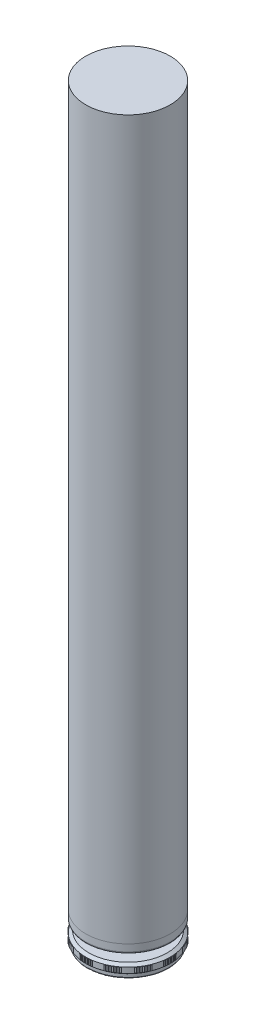
from build123d import *

# Parameters (mm, degrees)
CHANFREIN1_SIZE              = 2
CHANFREIN1_SIZE2             = 2.856296013
CONG_1_R                     = 2
CHANFREIN2_SIZE2             = 1.5
CHANFREIN2_SIZE              = 1.258649447
CONG_2_R                     = 1
BOSS_EXTRU_1_REACH           = 61.674
R_P_TITION_CIRCULAIRE1_COUNT = 12
ESQUISSE3_R                  = 40
BOSS_EXTRU_2_DEPTH           = 680


with BuildPart() as part:
    # Esquisse1 → Révolution1 (revolve)
    with BuildSketch(Plane.XY):
        Polygon((-25, 6.25), (-25, -2.25), (-40, -2.25), (-40, -10.75), (-38.5, -10.75), (-38.5, -14.75), (0, -14.75), (0, 14.75), (-40, 14.75), (-40, 6.25), align=None)
    revolve(axis=Axis((0, 36.374456522, 0), (0, -1, 0)))

    # Chanfrein1
    chanfrein1_edges = [part.edges().sort_by_distance(p)[0] for p in [
        (40, -2.25, 0),
    ]]
    chanfrein1_side = [part.faces().sort_by_distance(p)[0] for p in [
        (40, -6.5, 0),
    ]]
    chamfer(chanfrein1_edges, length=CHANFREIN1_SIZE, length2=CHANFREIN1_SIZE2, reference=chanfrein1_side[0])

    # Congé1
    cong_1_edges = [part.edges().sort_by_distance(p)[0] for p in [
        (40, 6.25, 0),
    ]]
    fillet(cong_1_edges, radius=CONG_1_R)

    # Chanfrein2
    chanfrein2_edges = [part.edges().sort_by_distance(p)[0] for p in [
        (40, -10.75, 0),
    ]]
    chanfrein2_side = [part.faces().sort_by_distance(p)[0] for p in [
        (40, -10.724827011, 0),
    ]]
    chamfer(chanfrein2_edges, length=CHANFREIN2_SIZE - 0.0001, length2=CHANFREIN2_SIZE2 - 0.0001, reference=chanfrein2_side[0])  # a hair under: the kernel refuses the full size

    # Congé2
    cong_2_edges = [part.edges().sort_by_distance(p)[0] for p in [
        (38.5, -14.75, 0),
    ]]
    fillet(cong_2_edges, radius=CONG_2_R)

    # Boss.-Extru.1: up to this cone (the profile starts inside it)
    boss_extru_1_end = Plane(origin=(0, -4.25, 0), z_dir=(0, 1, 0)).offset(-38.8053348) * Cone(1.192e-06, 175.456797598, 147.225733152, align=(Align.CENTER, Align.CENTER, Align.MIN), mode=Mode.PRIVATE)
    # Esquisse2 → Boss.-Extru.1 (add, up to the surface)
    with BuildSketch(Plane.XZ.offset(4.25), mode=Mode.PRIVATE) as boss_extru_1_sk1:
        with BuildLine():
            ThreePointArc((-4.915234348, -39.696857197), (-5.458128489, -39.625860664), (-6, -39.547439867))
            ThreePointArc((-6, -39.547439867), (-5.532838904, -40.168256193), (-4.915234348, -39.696857197))
        make_face()
    boss_extru_1_tool1 = extrude(boss_extru_1_sk1.sketch, amount=BOSS_EXTRU_1_REACH, mode=Mode.PRIVATE) & boss_extru_1_end
    # Esquisse2 → Boss.-Extru.1 (add, up to the surface)
    with BuildSketch(Plane.XZ.offset(4.25), mode=Mode.PRIVATE) as boss_extru_1_sk2:
        with BuildLine():
            ThreePointArc((-3.826785213, -39.816525651), (-4.371419293, -39.760416162), (-4.915234348, -39.696857197))
            ThreePointArc((-4.915234348, -39.696857197), (-4.431254922, -40.304653476), (-3.826785213, -39.816525651))
        make_face()
    boss_extru_1_tool2 = extrude(boss_extru_1_sk2.sketch, amount=BOSS_EXTRU_1_REACH, mode=Mode.PRIVATE) & boss_extru_1_end
    # Esquisse2 → Boss.-Extru.1 (add, up to the surface)
    with BuildSketch(Plane.XZ.offset(4.25), mode=Mode.PRIVATE) as boss_extru_1_sk3:
        with BuildLine():
            ThreePointArc((-2.73546828, -39.90635555), (-3.28143415, -39.865175152), (-3.826785213, -39.816525651))
            ThreePointArc((-3.826785213, -39.816525651), (-3.326350151, -40.410846398), (-2.73546828, -39.90635555))
        make_face()
    boss_extru_1_tool3 = extrude(boss_extru_1_sk3.sketch, amount=BOSS_EXTRU_1_REACH, mode=Mode.PRIVATE) & boss_extru_1_end
    # Esquisse2 → Boss.-Extru.1 (add, up to the surface)
    with BuildSketch(Plane.XZ.offset(4.25), mode=Mode.PRIVATE) as boss_extru_1_sk4:
        with BuildLine():
            ThreePointArc((-1.642101384, -39.966279575), (-2.188989895, -39.940059129), (-2.73546828, -39.90635555))
            ThreePointArc((-2.73546828, -39.90635555), (-2.21895261, -40.486755381), (-1.642101384, -39.966279575))
        make_face()
    boss_extru_1_tool4 = extrude(boss_extru_1_sk4.sketch, amount=BOSS_EXTRU_1_REACH, mode=Mode.PRIVATE) & boss_extru_1_end
    # Esquisse2 → Boss.-Extru.1 (add, up to the surface)
    with BuildSketch(Plane.XZ.offset(4.25), mode=Mode.PRIVATE) as boss_extru_1_sk5:
        with BuildLine():
            ThreePointArc((-0.547503895, -39.996252818), (-1.094905209, -39.985011974), (-1.642101384, -39.966279575))
            ThreePointArc((-1.642101384, -39.966279575), (-1.109892182, -40.532323537), (-0.547503895, -39.996252818))
        make_face()
    boss_extru_1_tool5 = extrude(boss_extru_1_sk5.sketch, amount=BOSS_EXTRU_1_REACH, mode=Mode.PRIVATE) & boss_extru_1_end
    # Esquisse2 → Boss.-Extru.1 (add, up to the surface)
    with BuildSketch(Plane.XZ.offset(4.25), mode=Mode.PRIVATE) as boss_extru_1_sk6:
        with BuildLine():
            ThreePointArc((0.547503895, -39.996252818), (0, -40), (-0.547503895, -39.996252818))
            ThreePointArc((-0.547503895, -39.996252818), (0, -40.547516718), (0.547503895, -39.996252818))
        make_face()
    boss_extru_1_tool6 = extrude(boss_extru_1_sk6.sketch, amount=BOSS_EXTRU_1_REACH, mode=Mode.PRIVATE) & boss_extru_1_end
    # Esquisse2 → Boss.-Extru.1 (add, up to the surface)
    with BuildSketch(Plane.XZ.offset(4.25), mode=Mode.PRIVATE) as boss_extru_1_sk7:
        with BuildLine():
            ThreePointArc((1.642101384, -39.966279575), (1.094905209, -39.985011974), (0.547503895, -39.996252818))
            ThreePointArc((0.547503895, -39.996252818), (1.109892182, -40.532323537), (1.642101384, -39.966279575))
        make_face()
    boss_extru_1_tool7 = extrude(boss_extru_1_sk7.sketch, amount=BOSS_EXTRU_1_REACH, mode=Mode.PRIVATE) & boss_extru_1_end
    # Esquisse2 → Boss.-Extru.1 (add, up to the surface)
    with BuildSketch(Plane.XZ.offset(4.25), mode=Mode.PRIVATE) as boss_extru_1_sk8:
        with BuildLine():
            ThreePointArc((2.73546828, -39.90635555), (2.188989895, -39.940059129), (1.642101384, -39.966279575))
            ThreePointArc((1.642101384, -39.966279575), (2.21895261, -40.486755381), (2.73546828, -39.90635555))
        make_face()
    boss_extru_1_tool8 = extrude(boss_extru_1_sk8.sketch, amount=BOSS_EXTRU_1_REACH, mode=Mode.PRIVATE) & boss_extru_1_end
    # Esquisse2 → Boss.-Extru.1 (add, up to the surface)
    with BuildSketch(Plane.XZ.offset(4.25), mode=Mode.PRIVATE) as boss_extru_1_sk9:
        with BuildLine():
            ThreePointArc((3.826785213, -39.816525651), (3.28143415, -39.865175152), (2.73546828, -39.90635555))
            ThreePointArc((2.73546828, -39.90635555), (3.326350151, -40.410846398), (3.826785213, -39.816525651))
        make_face()
    boss_extru_1_tool9 = extrude(boss_extru_1_sk9.sketch, amount=BOSS_EXTRU_1_REACH, mode=Mode.PRIVATE) & boss_extru_1_end
    # Esquisse2 → Boss.-Extru.1 (add, up to the surface)
    with BuildSketch(Plane.XZ.offset(4.25), mode=Mode.PRIVATE) as boss_extru_1_sk10:
        with BuildLine():
            ThreePointArc((4.915234348, -39.696857197), (4.371419293, -39.760416162), (3.826785213, -39.816525651))
            ThreePointArc((3.826785213, -39.816525651), (4.431254922, -40.304653476), (4.915234348, -39.696857197))
        make_face()
    boss_extru_1_tool10 = extrude(boss_extru_1_sk10.sketch, amount=BOSS_EXTRU_1_REACH, mode=Mode.PRIVATE) & boss_extru_1_end
    # Esquisse2 → Boss.-Extru.1 (add, up to the surface)
    with BuildSketch(Plane.XZ.offset(4.25), mode=Mode.PRIVATE) as boss_extru_1_sk11:
        with BuildLine():
            ThreePointArc((6, -39.547439867), (5.458128489, -39.625860664), (4.915234348, -39.696857197))
            ThreePointArc((4.915234348, -39.696857197), (5.532838904, -40.168256193), (6, -39.547439867))
        make_face()
    boss_extru_1_tool11 = extrude(boss_extru_1_sk11.sketch, amount=BOSS_EXTRU_1_REACH, mode=Mode.PRIVATE) & boss_extru_1_end
    boss_extru_1 = boss_extru_1_tool1.solids().sort_by_distance((-5.489744, -4.25, -39.855391))[0] + boss_extru_1_tool2.solids().sort_by_distance((-4.39674, -4.25, -39.990725))[0] + boss_extru_1_tool3.solids().sort_by_distance((-3.300442, -4.25, -40.096091))[0] + boss_extru_1_tool4.solids().sort_by_distance((-2.201669, -4.25, -40.171409))[0] + boss_extru_1_tool5.solids().sort_by_distance((-1.101247, -4.25, -40.216622))[0] + boss_extru_1_tool6.solids().sort_by_distance((0, -4.25, -40.231697))[0] + boss_extru_1_tool7.solids().sort_by_distance((1.101247, -4.25, -40.216622))[0] + boss_extru_1_tool8.solids().sort_by_distance((2.201669, -4.25, -40.171409))[0] + boss_extru_1_tool9.solids().sort_by_distance((3.300442, -4.25, -40.096091))[0] + boss_extru_1_tool10.solids().sort_by_distance((4.39674, -4.25, -39.990725))[0] + boss_extru_1_tool11.solids().sort_by_distance((5.489744, -4.25, -39.855391))[0]
    add(boss_extru_1)

    # Répétition circulaire1: Boss.-Extru.1 ×12 about axis
    r_p_tition_circulaire1_axis = Axis((0, 0, 0), (0, 1, 0))
    for i in range(1, R_P_TITION_CIRCULAIRE1_COUNT):
        add(boss_extru_1.rotate(r_p_tition_circulaire1_axis, i * 360 / R_P_TITION_CIRCULAIRE1_COUNT))


with BuildPart() as body_2:
    # Esquisse3 → Boss.-Extru.2 (new body)
    with BuildSketch(Plane(origin=(0, 14.75, 0), x_dir=(1, 0, 0), z_dir=(0, 1, 0))):
        with Locations(Location((0, 0, 0), (0, 0, 180))):
            Circle(ESQUISSE3_R)
    extrude(amount=BOSS_EXTRU_2_DEPTH)


solid = Compound([part.part, body_2.part])
